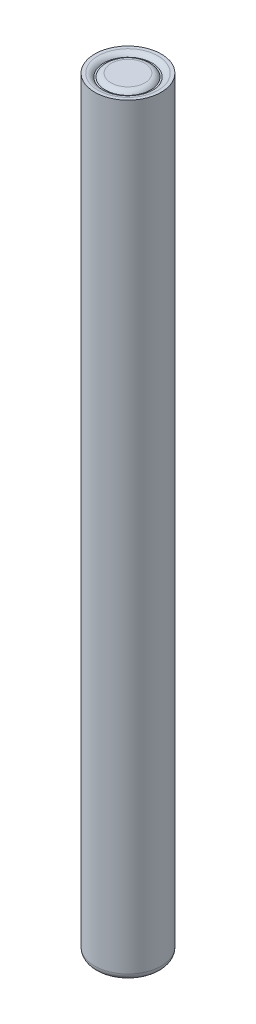
from build123d import *

# Parameters (mm, degrees)
SKETCH1_R           = 5
BOSS_EXTRUDE1_DEPTH = 115
SKETCH2_R           = 1.5
BOSS_EXTRUDE2_DEPTH = 1
SKETCH3_R           = 0.5
BOSS_EXTRUDE3_DEPTH = 0.5
SKETCH4_R           = 3.63725935
SKETCH4_R_2         = 3.411929034
CUT_EXTRUDE1_DEPTH  = 0.5
FILLET1_R           = 1
FILLET2_R           = 1
FILLET6_R           = 0.55
FILLET7_R           = 0.1


with BuildPart() as part:
    # Sketch1 → Boss-Extrude1 (new body)
    with BuildSketch(Plane(origin=(0, 0, 0), x_dir=(1, 0, 0), z_dir=(0, 1, 0))):
        with Locations(Location((0, 0, 0), (0, 0, 270))):
            Circle(SKETCH1_R)
    extrude(amount=BOSS_EXTRUDE1_DEPTH)

    # Sketch2 → Boss-Extrude2 (add)
    with BuildSketch(Plane.XZ):
        with Locations(Location((0, 0, 0), (0, 0, 90))):
            Circle(SKETCH2_R)
    extrude(amount=BOSS_EXTRUDE2_DEPTH)

    # Sketch3 → Boss-Extrude3 (add)
    with BuildSketch(Plane.XZ.offset(1)):
        with Locations(Location((0, 0, 0), (0, 0, 270))):
            Circle(SKETCH3_R)
    extrude(amount=BOSS_EXTRUDE3_DEPTH)

    # Sketch4 → Cut-Extrude1 (cut)
    with BuildSketch(Plane(origin=(0, 115, 0), x_dir=(1, 0, 0), z_dir=(0, 1, 0))):
        with Locations(Location((0, 0, 0), (0, 0, 270))):
            Circle(SKETCH4_R)
        with Locations(Location((0, 0, 0), (0, 0, 270))):
            Circle(SKETCH4_R_2, mode=Mode.SUBTRACT)
    extrude(amount=-CUT_EXTRUDE1_DEPTH, mode=Mode.SUBTRACT)

    # Fillet1
    # the kernel refuses this fillet: 1 mm, written as the material it takes off along each edge
    with BuildSketch(Plane(origin=(0, 115, 0), x_dir=(0, 0, 1), z_dir=(-1, 0, 0))) as fillet1_piece_1:
        with BuildLine():
            CenterArc((4.503284754, -1), FILLET1_R, 90, 60)
            Line((3.63725935, -0.5), (3.619938842, -0.49))
            ThreePointArc((3.619938842, -0.49), (3.61725935, -0.25), (3.61725935, 0))
            Line((3.61725935, 0), (3.63725935, 0.02))
            Line((3.63725935, 0.02), (4.503284754, 0.02))
            Line((4.503284754, 0.02), (4.503284754, 0))
        make_face()
    revolve(axis=Axis((0, 115, 0), (0, 1, 0)), mode=Mode.SUBTRACT)
    with BuildSketch(Plane(origin=(0, 115, 0), x_dir=(0, 0, 1), z_dir=(-1, 0, 0))) as fillet1_piece_2:
        with BuildLine():
            CenterArc((2.545903631, -1), FILLET1_R, 30, 60)
            Line((2.545903631, 0), (2.545903631, 0.02))
            Line((2.545903631, 0.02), (3.411929034, 0.02))
            Line((3.411929034, 0.02), (3.431929034, 0))
            ThreePointArc((3.431929034, 0), (3.431929034, -0.25), (3.429249543, -0.49))
            Line((3.429249543, -0.49), (3.411929034, -0.5))
        make_face()
    revolve(axis=Axis((0, 115, 0), (0, 1, 0)), mode=Mode.SUBTRACT)

    # Fillet2
    fillet2_edges = [part.edges().sort_by_distance(p)[0] for p in [
        (0, 0, -5),
    ]]
    fillet(fillet2_edges, radius=FILLET2_R)

    # Fillet6
    fillet6_edges = [part.edges().sort_by_distance(p)[0] for p in [
        (0, -1, -1.5),
    ]]
    fillet(fillet6_edges, radius=FILLET6_R)

    # Fillet7
    fillet7_edges = [part.edges().sort_by_distance(p)[0] for p in [
        (0, -1.5, 0.5),
    ]]
    fillet(fillet7_edges, radius=FILLET7_R)


solid = part.part
